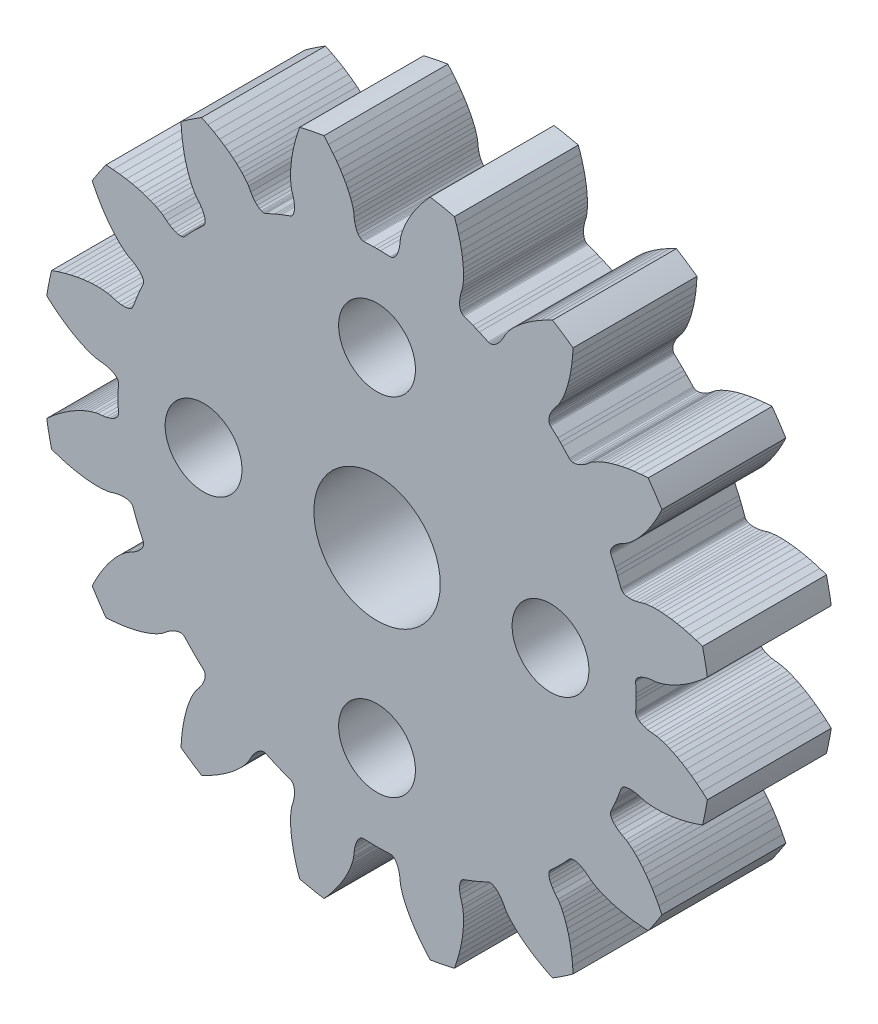
from build123d import *

# Parameters (mm, degrees)
SZKIC_R    = 1.55
SZKIC_R_2  = 2.55
GEAR_DEPTH = 5


with BuildPart() as part:
    # szkic → gear (new body)
    with BuildSketch(Plane.XY):
        with BuildLine():
            Line((-11.37066852, -6.827485358), (-11.23626822, -6.579289758))
            Line((-11.23626822, -6.579289758), (-11.10183292, -6.354069758))
            Line((-11.10183292, -6.354069758), (-10.96824992, -6.150179558))
            Line((-10.96824992, -6.150179558), (-10.83837372, -5.968985458))
            Line((-10.83837372, -5.968985458), (-10.71234172, -5.807881858))
            Line((-10.71234172, -5.807881858), (-10.59417062, -5.669192658))
            Line((-10.59417062, -5.669192658), (-10.48250752, -5.548709858))
            Line((-10.48250752, -5.548709858), (-10.38077062, -5.447719358))
            Line((-10.38077062, -5.447719358), (-10.28935352, -5.364251958))
            Line((-10.28935352, -5.364251958), (-10.14089462, -5.244330758))
            Line((-10.14089462, -5.244330758), (-10.04920092, -5.182017758))
            Line((-10.04920092, -5.182017758), (-9.88902632, -5.097985058))
            Line((-9.88902632, -5.097985058), (-9.75070002, -5.012004958))
            Line((-9.75070002, -5.012004958), (-9.63676772, -4.924255458))
            Line((-9.63676772, -4.924255458), (-9.54711732, -4.836627458))
            Line((-9.54711732, -4.836627458), (-9.48149032, -4.750972958))
            Line((-9.48149032, -4.750972958), (-9.43952592, -4.669155958))
            Line((-9.43952592, -4.669155958), (-9.42728302, -4.630249258))
            Line((-9.42728302, -4.630249258), (-9.42075652, -4.592985058))
            Line((-9.42075652, -4.592985058), (-9.41989942, -4.557582158))
            Line((-9.41989942, -4.557582158), (-9.42461042, -4.524258458))
            Line((-9.42461042, -4.524258458), (-9.43819712, -4.485865258))
            Line((-9.43819712, -4.485865258), (-9.60120132, -4.125525058))
            Line((-9.60120132, -4.125525058), (-9.65453602, -3.999037058))
            Line((-9.65453602, -3.999037058), (-9.70626322, -3.871883158))
            Line((-9.70626322, -3.871883158), (-9.84580092, -3.501822758))
            Line((-9.84580092, -3.501822758), (-9.86334172, -3.465067458))
            Line((-9.86334172, -3.465067458), (-9.88357392, -3.438172758))
            Line((-9.88357392, -3.438172758), (-9.90921372, -3.413745258))
            Line((-9.90921372, -3.413745258), (-9.94017832, -3.392010458))
            Line((-9.94017832, -3.392010458), (-9.97634662, -3.373156258))
            Line((-9.97634662, -3.373156258), (-10.06387322, -3.344976158))
            Line((-10.06387322, -3.344976158), (-10.17084542, -3.330814658))
            Line((-10.17084542, -3.330814658), (-10.29620022, -3.332244758))
            Line((-10.29620022, -3.332244758), (-10.43881072, -3.350758758))
            Line((-10.43881072, -3.350758758), (-10.59741932, -3.387773158))
            Line((-10.59741932, -3.387773158), (-10.77010002, -3.441613558))
            Line((-10.77010002, -3.441613558), (-10.87899912, -3.462388858))
            Line((-10.87899912, -3.462388858), (-11.06877252, -3.482568058))
            Line((-11.06877252, -3.482568058), (-11.19243452, -3.488189358))
            Line((-11.19243452, -3.488189358), (-11.33578442, -3.488717158))
            Line((-11.33578442, -3.488717158), (-11.49993632, -3.482480658))
            Line((-11.49993632, -3.482480658), (-11.68156412, -3.467972158))
            Line((-11.68156412, -3.467972158), (-11.88459952, -3.443172758))
            Line((-11.88459952, -3.443172758), (-12.10455952, -3.406885558))
            Line((-12.10455952, -3.406885558), (-12.34318912, -3.357170858))
            Line((-12.34318912, -3.357170858), (-12.59750382, -3.292976358))
            Line((-12.59750382, -3.292976358), (-12.86803992, -3.212510958))
            Line((-12.86803992, -3.212510958), (-13.13417922, -3.121265658))
            ThreePointArc((-13.13417922, -3.121265658), (-13.240566525, -2.633710984), (-13.328861789, -2.142557479))
            Line((-13.328861789, -2.142557479), (-13.117899289, -1.956410679))
            Line((-13.117899289, -1.956410679), (-12.898749289, -1.778540679))
            Line((-12.898749289, -1.778540679), (-12.688359289, -1.621910679))
            Line((-12.688359289, -1.621910679), (-12.486919289, -1.484660679))
            Line((-12.486919289, -1.484660679), (-12.297589289, -1.366960679))
            Line((-12.297589289, -1.366960679), (-12.119499289, -1.266350679))
            Line((-12.119499289, -1.266350679), (-11.957249289, -1.183440679))
            Line((-11.957249289, -1.183440679), (-11.807979289, -1.114860679))
            Line((-11.807979289, -1.114860679), (-11.675339289, -1.060490679))
            Line((-11.675339289, -1.060490679), (-11.558939289, -1.018360679))
            Line((-11.558939289, -1.018360679), (-11.375889289, -0.964380679))
            Line((-11.375889289, -0.964380679), (-11.267329289, -0.941900679))
            Line((-11.267329289, -0.941900679), (-11.087189289, -0.925560679))
            Line((-11.087189289, -0.925560679), (-10.926489289, -0.899060679))
            Line((-10.926489289, -0.899060679), (-10.787649289, -0.861590679))
            Line((-10.787649289, -0.861590679), (-10.671289289, -0.814940679))
            Line((-10.671289289, -0.814940679), (-10.577879289, -0.760920679))
            Line((-10.577879289, -0.760920679), (-10.507799289, -0.701390679))
            Line((-10.507799289, -0.701390679), (-10.481599289, -0.670130679))
            Line((-10.481599289, -0.670130679), (-10.461309289, -0.638200679))
            Line((-10.461309289, -0.638200679), (-10.446969289, -0.605820679))
            Line((-10.446969289, -0.605820679), (-10.438569289, -0.573230679))
            Line((-10.438569289, -0.573230679), (-10.436429289, -0.532560679))
            Line((-10.436429289, -0.532560679), (-10.449129289, -0.137270679))
            Line((-10.449129289, -0.137270679), (-10.449999289, -6.79e-07))
            Line((-10.449999289, -6.79e-07), (-10.449129289, 0.137269321))
            Line((-10.449129289, 0.137269321), (-10.436429289, 0.532559321))
            Line((-10.436429289, 0.532559321), (-10.438569289, 0.573229321))
            Line((-10.438569289, 0.573229321), (-10.446969289, 0.605819321))
            Line((-10.446969289, 0.605819321), (-10.461309289, 0.638199321))
            Line((-10.461309289, 0.638199321), (-10.481599289, 0.670129321))
            Line((-10.481599289, 0.670129321), (-10.507799289, 0.701389321))
            Line((-10.507799289, 0.701389321), (-10.577879289, 0.760919321))
            Line((-10.577879289, 0.760919321), (-10.671289289, 0.814939321))
            Line((-10.671289289, 0.814939321), (-10.787649289, 0.861589321))
            Line((-10.787649289, 0.861589321), (-10.926489289, 0.899059321))
            Line((-10.926489289, 0.899059321), (-11.087189289, 0.925559321))
            Line((-11.087189289, 0.925559321), (-11.267329289, 0.941899321))
            Line((-11.267329289, 0.941899321), (-11.375889289, 0.964379321))
            Line((-11.375889289, 0.964379321), (-11.558939289, 1.018359321))
            Line((-11.558939289, 1.018359321), (-11.675339289, 1.060489321))
            Line((-11.675339289, 1.060489321), (-11.807979289, 1.114859321))
            Line((-11.807979289, 1.114859321), (-11.957249289, 1.183439321))
            Line((-11.957249289, 1.183439321), (-12.119499289, 1.266349321))
            Line((-12.119499289, 1.266349321), (-12.297589289, 1.366959321))
            Line((-12.297589289, 1.366959321), (-12.486919289, 1.484659321))
            Line((-12.486919289, 1.484659321), (-12.688359289, 1.621909321))
            Line((-12.688359289, 1.621909321), (-12.898749289, 1.778539321))
            Line((-12.898749289, 1.778539321), (-13.117899289, 1.956409321))
            Line((-13.117899289, 1.956409321), (-13.328861789, 2.142556121))
            ThreePointArc((-13.328861789, 2.142556121), (-13.240568802, 2.633712354), (-13.134183589, 3.121269821))
            Line((-13.134183589, 3.121269821), (-12.868044289, 3.212515121))
            Line((-12.868044289, 3.212515121), (-12.597508189, 3.292980521))
            Line((-12.597508189, 3.292980521), (-12.343193489, 3.357175021))
            Line((-12.343193489, 3.357175021), (-12.104563889, 3.406889721))
            Line((-12.104563889, 3.406889721), (-11.884603889, 3.443176921))
            Line((-11.884603889, 3.443176921), (-11.681568489, 3.467976321))
            Line((-11.681568489, 3.467976321), (-11.499940689, 3.482484821))
            Line((-11.499940689, 3.482484821), (-11.335788789, 3.488721321))
            Line((-11.335788789, 3.488721321), (-11.192438889, 3.488193521))
            Line((-11.192438889, 3.488193521), (-11.068776889, 3.482572221))
            Line((-11.068776889, 3.482572221), (-10.879003489, 3.462393021))
            Line((-10.879003489, 3.462393021), (-10.770104389, 3.441617721))
            Line((-10.770104389, 3.441617721), (-10.597423689, 3.387777321))
            Line((-10.597423689, 3.387777321), (-10.438815089, 3.350762921))
            Line((-10.438815089, 3.350762921), (-10.296204589, 3.332248921))
            Line((-10.296204589, 3.332248921), (-10.170849789, 3.330818821))
            Line((-10.170849789, 3.330818821), (-10.063877589, 3.344980321))
            Line((-10.063877589, 3.344980321), (-9.976350989, 3.373160421))
            Line((-9.976350989, 3.373160421), (-9.940182689, 3.392014621))
            Line((-9.940182689, 3.392014621), (-9.909218089, 3.413749421))
            Line((-9.909218089, 3.413749421), (-9.883578289, 3.438176921))
            Line((-9.883578289, 3.438176921), (-9.863346089, 3.465071621))
            Line((-9.863346089, 3.465071621), (-9.845805289, 3.501826921))
            Line((-9.845805289, 3.501826921), (-9.706267589, 3.871887321))
            Line((-9.706267589, 3.871887321), (-9.654540389, 3.999041221))
            Line((-9.654540389, 3.999041221), (-9.601205689, 4.125529221))
            Line((-9.601205689, 4.125529221), (-9.438201489, 4.485869421))
            Line((-9.438201489, 4.485869421), (-9.424614789, 4.524262621))
            Line((-9.424614789, 4.524262621), (-9.419903789, 4.557586321))
            Line((-9.419903789, 4.557586321), (-9.420760889, 4.592989221))
            Line((-9.420760889, 4.592989221), (-9.427287389, 4.630253421))
            Line((-9.427287389, 4.630253421), (-9.439530289, 4.669160121))
            Line((-9.439530289, 4.669160121), (-9.481494689, 4.750977121))
            Line((-9.481494689, 4.750977121), (-9.547121689, 4.836631621))
            Line((-9.547121689, 4.836631621), (-9.636772089, 4.924259621))
            Line((-9.636772089, 4.924259621), (-9.750704389, 5.012009121))
            Line((-9.750704389, 5.012009121), (-9.889030689, 5.097989221))
            Line((-9.889030689, 5.097989221), (-10.049205289, 5.182021921))
            Line((-10.049205289, 5.182021921), (-10.140898989, 5.244334921))
            Line((-10.140898989, 5.244334921), (-10.289357889, 5.364256121))
            Line((-10.289357889, 5.364256121), (-10.380774989, 5.447723521))
            Line((-10.380774989, 5.447723521), (-10.482511889, 5.548714021))
            Line((-10.482511889, 5.548714021), (-10.594174989, 5.669196821))
            Line((-10.594174989, 5.669196821), (-10.712346089, 5.807886021))
            Line((-10.712346089, 5.807886021), (-10.838378089, 5.968989621))
            Line((-10.838378089, 5.968989621), (-10.968254289, 6.150183721))
            Line((-10.968254289, 6.150183721), (-11.101837289, 6.354073921))
            Line((-11.101837289, 6.354073921), (-11.236272589, 6.579293921))
            Line((-11.236272589, 6.579293921), (-11.370672889, 6.827489521))
            Line((-11.370672889, 6.827489521), (-11.494341589, 7.080198521))
            ThreePointArc((-11.494341589, 7.080198521), (-11.224812159, 7.500179363), (-10.939944885, 7.909911786))
            Line((-10.939944885, 7.909911786), (-10.659146185, 7.892364486))
            Line((-10.659146185, 7.892364486), (-10.378410685, 7.863175086))
            Line((-10.378410685, 7.863175086), (-10.118888385, 7.825160986))
            Line((-10.118888385, 7.825160986), (-9.879398385, 7.779771886))
            Line((-9.879398385, 7.779771886), (-9.662295385, 7.729121786))
            Line((-9.662295385, 7.729121786), (-9.465224685, 7.674335186))
            Line((-9.465224685, 7.674335186), (-9.291870385, 7.618233286))
            Line((-9.291870385, 7.618233286), (-9.137827185, 7.561176886))
            Line((-9.137827185, 7.561176886), (-9.005591185, 7.505831586))
            Line((-9.005591185, 7.505831586), (-8.893493485, 7.453314786))
            Line((-8.893493485, 7.453314786), (-8.725887985, 7.362048486))
            Line((-8.725887985, 7.362048486), (-8.633228685, 7.301180786))
            Line((-8.633228685, 7.301180786), (-8.494296385, 7.185356686))
            Line((-8.494296385, 7.185356686), (-8.361925985, 7.090462986))
            Line((-8.361925985, 7.090462986), (-8.237255985, 7.018783486))
            Line((-8.237255985, 7.018783486), (-8.121990485, 6.969491086))
            Line((-8.121990485, 6.969491086), (-8.017741785, 6.941638186))
            Line((-8.017741785, 6.941638186), (-7.926093685, 6.934178186))
            Line((-7.926093685, 6.934178186), (-7.885463285, 6.937756186))
            Line((-7.885463285, 6.937756186), (-7.848538185, 6.945986886))
            Line((-7.848538185, 6.945986886), (-7.815502185, 6.958743086))
            Line((-7.815502185, 6.958743086), (-7.786517885, 6.975847986))
            Line((-7.786517885, 6.975847986), (-7.756246585, 7.003092786))
            Line((-7.756246585, 7.003092786), (-7.485714585, 7.291585286))
            Line((-7.485714585, 7.291585286), (-7.389265285, 7.389265086))
            Line((-7.389265285, 7.389265086), (-7.291585485, 7.485714386))
            Line((-7.291585485, 7.485714386), (-7.003092985, 7.756246386))
            Line((-7.003092985, 7.756246386), (-6.975848185, 7.786517686))
            Line((-6.975848185, 7.786517686), (-6.958743285, 7.815501986))
            Line((-6.958743285, 7.815501986), (-6.945987085, 7.848537986))
            Line((-6.945987085, 7.848537986), (-6.937756385, 7.885463086))
            Line((-6.937756385, 7.885463086), (-6.934178385, 7.926093486))
            Line((-6.934178385, 7.926093486), (-6.941638385, 8.017741586))
            Line((-6.941638385, 8.017741586), (-6.969491285, 8.121990286))
            Line((-6.969491285, 8.121990286), (-7.018783685, 8.237255786))
            Line((-7.018783685, 8.237255786), (-7.090463185, 8.361925786))
            Line((-7.090463185, 8.361925786), (-7.185356885, 8.494296186))
            Line((-7.185356885, 8.494296186), (-7.301180985, 8.633228486))
            Line((-7.301180985, 8.633228486), (-7.362048685, 8.725887786))
            Line((-7.362048685, 8.725887786), (-7.453314985, 8.893493286))
            Line((-7.453314985, 8.893493286), (-7.505831785, 9.005590986))
            Line((-7.505831785, 9.005590986), (-7.561177085, 9.137826986))
            Line((-7.561177085, 9.137826986), (-7.618233485, 9.291870186))
            Line((-7.618233485, 9.291870186), (-7.674335385, 9.465224486))
            Line((-7.674335385, 9.465224486), (-7.729121985, 9.662295186))
            Line((-7.729121985, 9.662295186), (-7.779772085, 9.879398186))
            Line((-7.779772085, 9.879398186), (-7.825161185, 10.118888186))
            Line((-7.825161185, 10.118888186), (-7.863175285, 10.378410486))
            Line((-7.863175285, 10.378410486), (-7.892364685, 10.659145986))
            Line((-7.892364685, 10.659145986), (-7.909911985, 10.939944686))
            ThreePointArc((-7.909911985, 10.939944686), (-7.500179744, 11.224812366), (-7.080199065, 11.494342204))
            Line((-7.080199065, 11.494342204), (-6.827490065, 11.370673504))
            Line((-6.827490065, 11.370673504), (-6.579294465, 11.236273204))
            Line((-6.579294465, 11.236273204), (-6.354074465, 11.101837904))
            Line((-6.354074465, 11.101837904), (-6.150184265, 10.968254904))
            Line((-6.150184265, 10.968254904), (-5.968990165, 10.838378704))
            Line((-5.968990165, 10.838378704), (-5.807886565, 10.712346704))
            Line((-5.807886565, 10.712346704), (-5.669197365, 10.594175604))
            Line((-5.669197365, 10.594175604), (-5.548714565, 10.482512504))
            Line((-5.548714565, 10.482512504), (-5.447724065, 10.380775604))
            Line((-5.447724065, 10.380775604), (-5.364256665, 10.289358504))
            Line((-5.364256665, 10.289358504), (-5.244335465, 10.140899604))
            Line((-5.244335465, 10.140899604), (-5.182022465, 10.049205904))
            Line((-5.182022465, 10.049205904), (-5.097989765, 9.889031304))
            Line((-5.097989765, 9.889031304), (-5.012009665, 9.750705004))
            Line((-5.012009665, 9.750705004), (-4.924260165, 9.636772704))
            Line((-4.924260165, 9.636772704), (-4.836632165, 9.547122304))
            Line((-4.836632165, 9.547122304), (-4.750977665, 9.481495304))
            Line((-4.750977665, 9.481495304), (-4.669160665, 9.439530904))
            Line((-4.669160665, 9.439530904), (-4.630253965, 9.427288004))
            Line((-4.630253965, 9.427288004), (-4.592989765, 9.420761504))
            Line((-4.592989765, 9.420761504), (-4.557586865, 9.419904404))
            Line((-4.557586865, 9.419904404), (-4.524263165, 9.424615404))
            Line((-4.524263165, 9.424615404), (-4.485869965, 9.438202104))
            Line((-4.485869965, 9.438202104), (-4.125529765, 9.601206304))
            Line((-4.125529765, 9.601206304), (-3.999041765, 9.654541004))
            Line((-3.999041765, 9.654541004), (-3.871887865, 9.706268204))
            Line((-3.871887865, 9.706268204), (-3.501827465, 9.845805904))
            Line((-3.501827465, 9.845805904), (-3.465072165, 9.863346704))
            Line((-3.465072165, 9.863346704), (-3.438177465, 9.883578904))
            Line((-3.438177465, 9.883578904), (-3.413749965, 9.909218704))
            Line((-3.413749965, 9.909218704), (-3.392015165, 9.940183304))
            Line((-3.392015165, 9.940183304), (-3.373160965, 9.976351604))
            Line((-3.373160965, 9.976351604), (-3.344980865, 10.063878204))
            Line((-3.344980865, 10.063878204), (-3.330819365, 10.170850404))
            Line((-3.330819365, 10.170850404), (-3.332249465, 10.296205204))
            Line((-3.332249465, 10.296205204), (-3.350763465, 10.438815704))
            Line((-3.350763465, 10.438815704), (-3.387777865, 10.597424304))
            Line((-3.387777865, 10.597424304), (-3.441618265, 10.770105004))
            Line((-3.441618265, 10.770105004), (-3.462393565, 10.879004104))
            Line((-3.462393565, 10.879004104), (-3.482572765, 11.068777504))
            Line((-3.482572765, 11.068777504), (-3.488194065, 11.192439504))
            Line((-3.488194065, 11.192439504), (-3.488721865, 11.335789404))
            Line((-3.488721865, 11.335789404), (-3.482485365, 11.499941304))
            Line((-3.482485365, 11.499941304), (-3.467976865, 11.681569104))
            Line((-3.467976865, 11.681569104), (-3.443177465, 11.884604504))
            Line((-3.443177465, 11.884604504), (-3.406890265, 12.104564504))
            Line((-3.406890265, 12.104564504), (-3.357175565, 12.343194104))
            Line((-3.357175565, 12.343194104), (-3.292981065, 12.597508804))
            Line((-3.292981065, 12.597508804), (-3.212515665, 12.868044904))
            Line((-3.212515665, 12.868044904), (-3.121270365, 13.134184204))
            ThreePointArc((-3.121270365, 13.134184204), (-2.633712898, 13.240569417), (-2.142556665, 13.328862404))
            Line((-2.142556665, 13.328862404), (-1.956409865, 13.117899904))
            Line((-1.956409865, 13.117899904), (-1.778539865, 12.898749904))
            Line((-1.778539865, 12.898749904), (-1.621909865, 12.688359904))
            Line((-1.621909865, 12.688359904), (-1.484659865, 12.486919904))
            Line((-1.484659865, 12.486919904), (-1.366959865, 12.297589904))
            Line((-1.366959865, 12.297589904), (-1.266349865, 12.119499904))
            Line((-1.266349865, 12.119499904), (-1.183439865, 11.957249904))
            Line((-1.183439865, 11.957249904), (-1.114859865, 11.807979904))
            Line((-1.114859865, 11.807979904), (-1.060489865, 11.675339904))
            Line((-1.060489865, 11.675339904), (-1.018359865, 11.558939904))
            Line((-1.018359865, 11.558939904), (-0.964379865, 11.375889904))
            Line((-0.964379865, 11.375889904), (-0.941899865, 11.267329904))
            Line((-0.941899865, 11.267329904), (-0.925559865, 11.087189904))
            Line((-0.925559865, 11.087189904), (-0.899059865, 10.926489904))
            Line((-0.899059865, 10.926489904), (-0.861589865, 10.787649904))
            Line((-0.861589865, 10.787649904), (-0.814939865, 10.671289904))
            Line((-0.814939865, 10.671289904), (-0.760919865, 10.577879904))
            Line((-0.760919865, 10.577879904), (-0.701389865, 10.507799904))
            Line((-0.701389865, 10.507799904), (-0.670129865, 10.481599904))
            Line((-0.670129865, 10.481599904), (-0.638199865, 10.461309904))
            Line((-0.638199865, 10.461309904), (-0.605819865, 10.446969904))
            Line((-0.605819865, 10.446969904), (-0.573229865, 10.438569904))
            Line((-0.573229865, 10.438569904), (-0.532559865, 10.436429904))
            Line((-0.532559865, 10.436429904), (-0.137269865, 10.449129904))
            Line((-0.137269865, 10.449129904), (1.35e-07, 10.449999904))
            Line((1.35e-07, 10.449999904), (0.137270135, 10.449129904))
            Line((0.137270135, 10.449129904), (0.532560135, 10.436429904))
            Line((0.532560135, 10.436429904), (0.573230135, 10.438569904))
            Line((0.573230135, 10.438569904), (0.605820135, 10.446969904))
            Line((0.605820135, 10.446969904), (0.638200135, 10.461309904))
            Line((0.638200135, 10.461309904), (0.670130135, 10.481599904))
            Line((0.670130135, 10.481599904), (0.701390135, 10.507799904))
            Line((0.701390135, 10.507799904), (0.760920135, 10.577879904))
            Line((0.760920135, 10.577879904), (0.814940135, 10.671289904))
            Line((0.814940135, 10.671289904), (0.861590135, 10.787649904))
            Line((0.861590135, 10.787649904), (0.899060135, 10.926489904))
            Line((0.899060135, 10.926489904), (0.925560135, 11.087189904))
            Line((0.925560135, 11.087189904), (0.941900135, 11.267329904))
            Line((0.941900135, 11.267329904), (0.964380135, 11.375889904))
            Line((0.964380135, 11.375889904), (1.018360135, 11.558939904))
            Line((1.018360135, 11.558939904), (1.060490135, 11.675339904))
            Line((1.060490135, 11.675339904), (1.114860135, 11.807979904))
            Line((1.114860135, 11.807979904), (1.183440135, 11.957249904))
            Line((1.183440135, 11.957249904), (1.266350135, 12.119499904))
            Line((1.266350135, 12.119499904), (1.366960135, 12.297589904))
            Line((1.366960135, 12.297589904), (1.484660135, 12.486919904))
            Line((1.484660135, 12.486919904), (1.621910135, 12.688359904))
            Line((1.621910135, 12.688359904), (1.778540135, 12.898749904))
            Line((1.778540135, 12.898749904), (1.956410135, 13.117899904))
            Line((1.956410135, 13.117899904), (2.142556935, 13.328862404))
            ThreePointArc((2.142556935, 13.328862404), (2.633713168, 13.240569417), (3.121270635, 13.134184204))
            Line((3.121270635, 13.134184204), (3.212515935, 12.868044904))
            Line((3.212515935, 12.868044904), (3.292981335, 12.597508804))
            Line((3.292981335, 12.597508804), (3.357175835, 12.343194104))
            Line((3.357175835, 12.343194104), (3.406890535, 12.104564504))
            Line((3.406890535, 12.104564504), (3.443177735, 11.884604504))
            Line((3.443177735, 11.884604504), (3.467977135, 11.681569104))
            Line((3.467977135, 11.681569104), (3.482485635, 11.499941304))
            Line((3.482485635, 11.499941304), (3.488722135, 11.335789404))
            Line((3.488722135, 11.335789404), (3.488194335, 11.192439504))
            Line((3.488194335, 11.192439504), (3.482573035, 11.068777504))
            Line((3.482573035, 11.068777504), (3.462393835, 10.879004104))
            Line((3.462393835, 10.879004104), (3.441618535, 10.770105004))
            Line((3.441618535, 10.770105004), (3.387778135, 10.597424304))
            Line((3.387778135, 10.597424304), (3.350763735, 10.438815704))
            Line((3.350763735, 10.438815704), (3.332249735, 10.296205204))
            Line((3.332249735, 10.296205204), (3.330819635, 10.170850404))
            Line((3.330819635, 10.170850404), (3.344981135, 10.063878204))
            Line((3.344981135, 10.063878204), (3.373161235, 9.976351604))
            Line((3.373161235, 9.976351604), (3.392015435, 9.940183304))
            Line((3.392015435, 9.940183304), (3.413750235, 9.909218704))
            Line((3.413750235, 9.909218704), (3.438177735, 9.883578904))
            Line((3.438177735, 9.883578904), (3.465072435, 9.863346704))
            Line((3.465072435, 9.863346704), (3.501827735, 9.845805904))
            Line((3.501827735, 9.845805904), (3.871888135, 9.706268204))
            Line((3.871888135, 9.706268204), (3.999042035, 9.654541004))
            Line((3.999042035, 9.654541004), (4.125530035, 9.601206304))
            Line((4.125530035, 9.601206304), (4.485870235, 9.438202104))
            Line((4.485870235, 9.438202104), (4.524263435, 9.424615404))
            Line((4.524263435, 9.424615404), (4.557587135, 9.419904404))
            Line((4.557587135, 9.419904404), (4.592990035, 9.420761504))
            Line((4.592990035, 9.420761504), (4.630254235, 9.427288004))
            Line((4.630254235, 9.427288004), (4.669160935, 9.439530904))
            Line((4.669160935, 9.439530904), (4.750977935, 9.481495304))
            Line((4.750977935, 9.481495304), (4.836632435, 9.547122304))
            Line((4.836632435, 9.547122304), (4.924260435, 9.636772704))
            Line((4.924260435, 9.636772704), (5.012009935, 9.750705004))
            Line((5.012009935, 9.750705004), (5.097990035, 9.889031304))
            Line((5.097990035, 9.889031304), (5.182022735, 10.049205904))
            Line((5.182022735, 10.049205904), (5.244335735, 10.140899604))
            Line((5.244335735, 10.140899604), (5.364256935, 10.289358504))
            Line((5.364256935, 10.289358504), (5.447724335, 10.380775604))
            Line((5.447724335, 10.380775604), (5.548714835, 10.482512504))
            Line((5.548714835, 10.482512504), (5.669197635, 10.594175604))
            Line((5.669197635, 10.594175604), (5.807886835, 10.712346704))
            Line((5.807886835, 10.712346704), (5.968990435, 10.838378704))
            Line((5.968990435, 10.838378704), (6.150184535, 10.968254904))
            Line((6.150184535, 10.968254904), (6.354074735, 11.101837904))
            Line((6.354074735, 11.101837904), (6.579294735, 11.236273204))
            Line((6.579294735, 11.236273204), (6.827490335, 11.370673504))
            Line((6.827490335, 11.370673504), (7.080199335, 11.494342204))
            ThreePointArc((7.080199335, 11.494342204), (7.500180178, 11.224812774), (7.9099126, 10.9399455))
            Line((7.9099126, 10.9399455), (7.8923653, 10.6591468))
            Line((7.8923653, 10.6591468), (7.8631759, 10.3784113))
            Line((7.8631759, 10.3784113), (7.8251618, 10.118889))
            Line((7.8251618, 10.118889), (7.7797727, 9.879399))
            Line((7.7797727, 9.879399), (7.7291226, 9.662296))
            Line((7.7291226, 9.662296), (7.674336, 9.4652253))
            Line((7.674336, 9.4652253), (7.6182341, 9.291871))
            Line((7.6182341, 9.291871), (7.5611777, 9.1378278))
            Line((7.5611777, 9.1378278), (7.5058324, 9.0055918))
            Line((7.5058324, 9.0055918), (7.4533156, 8.8934941))
            Line((7.4533156, 8.8934941), (7.3620493, 8.7258886))
            Line((7.3620493, 8.7258886), (7.3011816, 8.6332293))
            Line((7.3011816, 8.6332293), (7.1853575, 8.494297))
            Line((7.1853575, 8.494297), (7.0904638, 8.3619266))
            Line((7.0904638, 8.3619266), (7.0187843, 8.2372566))
            Line((7.0187843, 8.2372566), (6.9694919, 8.1219911))
            Line((6.9694919, 8.1219911), (6.941639, 8.0177424))
            Line((6.941639, 8.0177424), (6.934179, 7.9260943))
            Line((6.934179, 7.9260943), (6.937757, 7.8854639))
            Line((6.937757, 7.8854639), (6.9459877, 7.8485388))
            Line((6.9459877, 7.8485388), (6.9587439, 7.8155028))
            Line((6.9587439, 7.8155028), (6.9758488, 7.7865185))
            Line((6.9758488, 7.7865185), (7.0030936, 7.7562472))
            Line((7.0030936, 7.7562472), (7.2915861, 7.4857152))
            Line((7.2915861, 7.4857152), (7.3892659, 7.3892659))
            Line((7.3892659, 7.3892659), (7.4857152, 7.2915861))
            Line((7.4857152, 7.2915861), (7.7562472, 7.0030936))
            Line((7.7562472, 7.0030936), (7.7865185, 6.9758488))
            Line((7.7865185, 6.9758488), (7.8155028, 6.9587439))
            Line((7.8155028, 6.9587439), (7.8485388, 6.9459877))
            Line((7.8485388, 6.9459877), (7.8854639, 6.937757))
            Line((7.8854639, 6.937757), (7.9260943, 6.934179))
            Line((7.9260943, 6.934179), (8.0177424, 6.941639))
            Line((8.0177424, 6.941639), (8.1219911, 6.9694919))
            Line((8.1219911, 6.9694919), (8.2372566, 7.0187843))
            Line((8.2372566, 7.0187843), (8.3619266, 7.0904638))
            Line((8.3619266, 7.0904638), (8.494297, 7.1853575))
            Line((8.494297, 7.1853575), (8.6332293, 7.3011816))
            Line((8.6332293, 7.3011816), (8.7258886, 7.3620493))
            Line((8.7258886, 7.3620493), (8.8934941, 7.4533156))
            Line((8.8934941, 7.4533156), (9.0055918, 7.5058324))
            Line((9.0055918, 7.5058324), (9.1378278, 7.5611777))
            Line((9.1378278, 7.5611777), (9.291871, 7.6182341))
            Line((9.291871, 7.6182341), (9.4652253, 7.674336))
            Line((9.4652253, 7.674336), (9.662296, 7.7291226))
            Line((9.662296, 7.7291226), (9.879399, 7.7797727))
            Line((9.879399, 7.7797727), (10.118889, 7.8251618))
            Line((10.118889, 7.8251618), (10.3784113, 7.8631759))
            Line((10.3784113, 7.8631759), (10.6591468, 7.8923653))
            Line((10.6591468, 7.8923653), (10.9399455, 7.9099126))
            ThreePointArc((10.9399455, 7.9099126), (11.22481318, 7.500180359), (11.494343018, 7.08019968))
            Line((11.494343018, 7.08019968), (11.370674318, 6.82749068))
            Line((11.370674318, 6.82749068), (11.236274018, 6.57929508))
            Line((11.236274018, 6.57929508), (11.101838718, 6.35407508))
            Line((11.101838718, 6.35407508), (10.968255718, 6.15018488))
            Line((10.968255718, 6.15018488), (10.838379518, 5.96899078))
            Line((10.838379518, 5.96899078), (10.712347518, 5.80788718))
            Line((10.712347518, 5.80788718), (10.594176418, 5.66919798))
            Line((10.594176418, 5.66919798), (10.482513318, 5.54871518))
            Line((10.482513318, 5.54871518), (10.380776418, 5.44772468))
            Line((10.380776418, 5.44772468), (10.289359318, 5.36425728))
            Line((10.289359318, 5.36425728), (10.140900418, 5.24433608))
            Line((10.140900418, 5.24433608), (10.049206718, 5.18202308))
            Line((10.049206718, 5.18202308), (9.889032118, 5.09799038))
            Line((9.889032118, 5.09799038), (9.750705818, 5.01201028))
            Line((9.750705818, 5.01201028), (9.636773518, 4.92426078))
            Line((9.636773518, 4.92426078), (9.547123118, 4.83663278))
            Line((9.547123118, 4.83663278), (9.481496118, 4.75097828))
            Line((9.481496118, 4.75097828), (9.439531718, 4.66916128))
            Line((9.439531718, 4.66916128), (9.427288818, 4.63025458))
            Line((9.427288818, 4.63025458), (9.420762318, 4.59299038))
            Line((9.420762318, 4.59299038), (9.419905218, 4.55758748))
            Line((9.419905218, 4.55758748), (9.424616218, 4.52426378))
            Line((9.424616218, 4.52426378), (9.438202918, 4.48587058))
            Line((9.438202918, 4.48587058), (9.601207118, 4.12553038))
            Line((9.601207118, 4.12553038), (9.654541818, 3.99904238))
            Line((9.654541818, 3.99904238), (9.706269018, 3.87188848))
            Line((9.706269018, 3.87188848), (9.845806718, 3.50182808))
            Line((9.845806718, 3.50182808), (9.863347518, 3.46507278))
            Line((9.863347518, 3.46507278), (9.883579718, 3.43817808))
            Line((9.883579718, 3.43817808), (9.909219518, 3.41375058))
            Line((9.909219518, 3.41375058), (9.940184118, 3.39201578))
            Line((9.940184118, 3.39201578), (9.976352418, 3.37316158))
            Line((9.976352418, 3.37316158), (10.063879018, 3.34498148))
            Line((10.063879018, 3.34498148), (10.170851218, 3.33081998))
            Line((10.170851218, 3.33081998), (10.296206018, 3.33225008))
            Line((10.296206018, 3.33225008), (10.438816518, 3.35076408))
            Line((10.438816518, 3.35076408), (10.597425118, 3.38777848))
            Line((10.597425118, 3.38777848), (10.770105818, 3.44161888))
            Line((10.770105818, 3.44161888), (10.879004918, 3.46239418))
            Line((10.879004918, 3.46239418), (11.068778318, 3.48257338))
            Line((11.068778318, 3.48257338), (11.192440318, 3.48819468))
            Line((11.192440318, 3.48819468), (11.335790218, 3.48872248))
            Line((11.335790218, 3.48872248), (11.499942118, 3.48248598))
            Line((11.499942118, 3.48248598), (11.681569918, 3.46797748))
            Line((11.681569918, 3.46797748), (11.884605318, 3.44317808))
            Line((11.884605318, 3.44317808), (12.104565318, 3.40689088))
            Line((12.104565318, 3.40689088), (12.343194918, 3.35717618))
            Line((12.343194918, 3.35717618), (12.597509618, 3.29298168))
            Line((12.597509618, 3.29298168), (12.868045718, 3.21251628))
            Line((12.868045718, 3.21251628), (13.134185018, 3.12127098))
            ThreePointArc((13.134185018, 3.12127098), (13.240570231, 2.633713513), (13.328863218, 2.14255728))
            Line((13.328863218, 2.14255728), (13.117900718, 1.95641048))
            Line((13.117900718, 1.95641048), (12.898750718, 1.77854048))
            Line((12.898750718, 1.77854048), (12.688360718, 1.62191048))
            Line((12.688360718, 1.62191048), (12.486920718, 1.48466048))
            Line((12.486920718, 1.48466048), (12.297590718, 1.36696048))
            Line((12.297590718, 1.36696048), (12.119500718, 1.26635048))
            Line((12.119500718, 1.26635048), (11.957250718, 1.18344048))
            Line((11.957250718, 1.18344048), (11.807980718, 1.11486048))
            Line((11.807980718, 1.11486048), (11.675340718, 1.06049048))
            Line((11.675340718, 1.06049048), (11.558940718, 1.01836048))
            Line((11.558940718, 1.01836048), (11.375890718, 0.96438048))
            Line((11.375890718, 0.96438048), (11.267330718, 0.94190048))
            Line((11.267330718, 0.94190048), (11.087190718, 0.92556048))
            Line((11.087190718, 0.92556048), (10.926490718, 0.89906048))
            Line((10.926490718, 0.89906048), (10.787650718, 0.86159048))
            Line((10.787650718, 0.86159048), (10.671290718, 0.81494048))
            Line((10.671290718, 0.81494048), (10.577880718, 0.76092048))
            Line((10.577880718, 0.76092048), (10.507800718, 0.70139048))
            Line((10.507800718, 0.70139048), (10.481600718, 0.67013048))
            Line((10.481600718, 0.67013048), (10.461310718, 0.63820048))
            Line((10.461310718, 0.63820048), (10.446970718, 0.60582048))
            Line((10.446970718, 0.60582048), (10.438570718, 0.57323048))
            Line((10.438570718, 0.57323048), (10.436430718, 0.53256048))
            Line((10.436430718, 0.53256048), (10.449130718, 0.13727048))
            Line((10.449130718, 0.13727048), (10.450000718, 4.8e-07))
            Line((10.450000718, 4.8e-07), (10.449130718, -0.13726952))
            Line((10.449130718, -0.13726952), (10.436430718, -0.53255952))
            Line((10.436430718, -0.53255952), (10.438570718, -0.57322952))
            Line((10.438570718, -0.57322952), (10.446970718, -0.60581952))
            Line((10.446970718, -0.60581952), (10.461310718, -0.63819952))
            Line((10.461310718, -0.63819952), (10.481600718, -0.67012952))
            Line((10.481600718, -0.67012952), (10.507800718, -0.70138952))
            Line((10.507800718, -0.70138952), (10.577880718, -0.76091952))
            Line((10.577880718, -0.76091952), (10.671290718, -0.81493952))
            Line((10.671290718, -0.81493952), (10.787650718, -0.86158952))
            Line((10.787650718, -0.86158952), (10.926490718, -0.89905952))
            Line((10.926490718, -0.89905952), (11.087190718, -0.92555952))
            Line((11.087190718, -0.92555952), (11.267330718, -0.94189952))
            Line((11.267330718, -0.94189952), (11.375890718, -0.96437952))
            Line((11.375890718, -0.96437952), (11.558940718, -1.01835952))
            Line((11.558940718, -1.01835952), (11.675340718, -1.06048952))
            Line((11.675340718, -1.06048952), (11.807980718, -1.11485952))
            Line((11.807980718, -1.11485952), (11.957250718, -1.18343952))
            Line((11.957250718, -1.18343952), (12.119500718, -1.26634952))
            Line((12.119500718, -1.26634952), (12.297590718, -1.36695952))
            Line((12.297590718, -1.36695952), (12.486920718, -1.48465952))
            Line((12.486920718, -1.48465952), (12.688360718, -1.62190952))
            Line((12.688360718, -1.62190952), (12.898750718, -1.77853952))
            Line((12.898750718, -1.77853952), (13.117900718, -1.95640952))
            Line((13.117900718, -1.95640952), (13.328863218, -2.14255632))
            ThreePointArc((13.328863218, -2.14255632), (13.240570231, -2.633712553), (13.134185018, -3.12127002))
            Line((13.134185018, -3.12127002), (12.868045718, -3.21251532))
            Line((12.868045718, -3.21251532), (12.597509618, -3.29298072))
            Line((12.597509618, -3.29298072), (12.343194918, -3.35717522))
            Line((12.343194918, -3.35717522), (12.104565318, -3.40688992))
            Line((12.104565318, -3.40688992), (11.884605318, -3.44317712))
            Line((11.884605318, -3.44317712), (11.681569918, -3.46797652))
            Line((11.681569918, -3.46797652), (11.499942118, -3.48248502))
            Line((11.499942118, -3.48248502), (11.335790218, -3.48872152))
            Line((11.335790218, -3.48872152), (11.192440318, -3.48819372))
            Line((11.192440318, -3.48819372), (11.068778318, -3.48257242))
            Line((11.068778318, -3.48257242), (10.879004918, -3.46239322))
            Line((10.879004918, -3.46239322), (10.770105818, -3.44161792))
            Line((10.770105818, -3.44161792), (10.597425118, -3.38777752))
            Line((10.597425118, -3.38777752), (10.438816518, -3.35076312))
            Line((10.438816518, -3.35076312), (10.296206018, -3.33224912))
            Line((10.296206018, -3.33224912), (10.170851218, -3.33081902))
            Line((10.170851218, -3.33081902), (10.063879018, -3.34498052))
            Line((10.063879018, -3.34498052), (9.976352418, -3.37316062))
            Line((9.976352418, -3.37316062), (9.940184118, -3.39201482))
            Line((9.940184118, -3.39201482), (9.909219518, -3.41374962))
            Line((9.909219518, -3.41374962), (9.883579718, -3.43817712))
            Line((9.883579718, -3.43817712), (9.863347518, -3.46507182))
            Line((9.863347518, -3.46507182), (9.845806718, -3.50182712))
            Line((9.845806718, -3.50182712), (9.706269018, -3.87188752))
            Line((9.706269018, -3.87188752), (9.654541818, -3.99904142))
            Line((9.654541818, -3.99904142), (9.601207118, -4.12552942))
            Line((9.601207118, -4.12552942), (9.438202918, -4.48586962))
            Line((9.438202918, -4.48586962), (9.424616218, -4.52426282))
            Line((9.424616218, -4.52426282), (9.419905218, -4.55758652))
            Line((9.419905218, -4.55758652), (9.420762318, -4.59298942))
            Line((9.420762318, -4.59298942), (9.427288818, -4.63025362))
            Line((9.427288818, -4.63025362), (9.439531718, -4.66916032))
            Line((9.439531718, -4.66916032), (9.481496118, -4.75097732))
            Line((9.481496118, -4.75097732), (9.547123118, -4.83663182))
            Line((9.547123118, -4.83663182), (9.636773518, -4.92425982))
            Line((9.636773518, -4.92425982), (9.750705818, -5.01200932))
            Line((9.750705818, -5.01200932), (9.889032118, -5.09798942))
            Line((9.889032118, -5.09798942), (10.049206718, -5.18202212))
            Line((10.049206718, -5.18202212), (10.140900418, -5.24433512))
            Line((10.140900418, -5.24433512), (10.289359318, -5.36425632))
            Line((10.289359318, -5.36425632), (10.380776418, -5.44772372))
            Line((10.380776418, -5.44772372), (10.482513318, -5.54871422))
            Line((10.482513318, -5.54871422), (10.594176418, -5.66919702))
            Line((10.594176418, -5.66919702), (10.712347518, -5.80788622))
            Line((10.712347518, -5.80788622), (10.838379518, -5.96898982))
            Line((10.838379518, -5.96898982), (10.968255718, -6.15018392))
            Line((10.968255718, -6.15018392), (11.101838718, -6.35407412))
            Line((11.101838718, -6.35407412), (11.236274018, -6.57929412))
            Line((11.236274018, -6.57929412), (11.370674318, -6.82748972))
            Line((11.370674318, -6.82748972), (11.494343018, -7.08019872))
            ThreePointArc((11.494343018, -7.08019872), (11.224814723, -7.500177576), (10.939948718, -7.909908097))
            Line((10.939948718, -7.909908097), (10.659150018, -7.892360797))
            Line((10.659150018, -7.892360797), (10.378414518, -7.863171397))
            Line((10.378414518, -7.863171397), (10.118892218, -7.825157297))
            Line((10.118892218, -7.825157297), (9.879402218, -7.779768197))
            Line((9.879402218, -7.779768197), (9.662299218, -7.729118097))
            Line((9.662299218, -7.729118097), (9.465228518, -7.674331497))
            Line((9.465228518, -7.674331497), (9.291874218, -7.618229597))
            Line((9.291874218, -7.618229597), (9.137831018, -7.561173197))
            Line((9.137831018, -7.561173197), (9.005595018, -7.505827897))
            Line((9.005595018, -7.505827897), (8.893497318, -7.453311097))
            Line((8.893497318, -7.453311097), (8.725891818, -7.362044797))
            Line((8.725891818, -7.362044797), (8.633232518, -7.301177097))
            Line((8.633232518, -7.301177097), (8.494300218, -7.185352997))
            Line((8.494300218, -7.185352997), (8.361929818, -7.090459297))
            Line((8.361929818, -7.090459297), (8.237259818, -7.018779797))
            Line((8.237259818, -7.018779797), (8.121994318, -6.969487397))
            Line((8.121994318, -6.969487397), (8.017745618, -6.941634497))
            Line((8.017745618, -6.941634497), (7.926097518, -6.934174497))
            Line((7.926097518, -6.934174497), (7.885467118, -6.937752497))
            Line((7.885467118, -6.937752497), (7.848542018, -6.945983197))
            Line((7.848542018, -6.945983197), (7.815506018, -6.958739397))
            Line((7.815506018, -6.958739397), (7.786521718, -6.975844297))
            Line((7.786521718, -6.975844297), (7.756250418, -7.003089097))
            Line((7.756250418, -7.003089097), (7.485718418, -7.291581597))
            Line((7.485718418, -7.291581597), (7.389269118, -7.389261397))
            Line((7.389269118, -7.389261397), (7.291589318, -7.485710697))
            Line((7.291589318, -7.485710697), (7.003096818, -7.756242697))
            Line((7.003096818, -7.756242697), (6.975852018, -7.786513997))
            Line((6.975852018, -7.786513997), (6.958747118, -7.815498297))
            Line((6.958747118, -7.815498297), (6.945990918, -7.848534297))
            Line((6.945990918, -7.848534297), (6.937760218, -7.885459397))
            Line((6.937760218, -7.885459397), (6.934182218, -7.926089797))
            Line((6.934182218, -7.926089797), (6.941642218, -8.017737897))
            Line((6.941642218, -8.017737897), (6.969495118, -8.121986597))
            Line((6.969495118, -8.121986597), (7.018787518, -8.237252097))
            Line((7.018787518, -8.237252097), (7.090467018, -8.361922097))
            Line((7.090467018, -8.361922097), (7.185360718, -8.494292497))
            Line((7.185360718, -8.494292497), (7.301184818, -8.633224797))
            Line((7.301184818, -8.633224797), (7.362052518, -8.725884097))
            Line((7.362052518, -8.725884097), (7.453318818, -8.893489597))
            Line((7.453318818, -8.893489597), (7.505835618, -9.005587297))
            Line((7.505835618, -9.005587297), (7.561180918, -9.137823297))
            Line((7.561180918, -9.137823297), (7.618237318, -9.291866497))
            Line((7.618237318, -9.291866497), (7.674339218, -9.465220797))
            Line((7.674339218, -9.465220797), (7.729125818, -9.662291497))
            Line((7.729125818, -9.662291497), (7.779775918, -9.879394497))
            Line((7.779775918, -9.879394497), (7.825165018, -10.118884497))
            Line((7.825165018, -10.118884497), (7.863179118, -10.378406797))
            Line((7.863179118, -10.378406797), (7.892368518, -10.659142297))
            Line((7.892368518, -10.659142297), (7.909915818, -10.939940997))
            ThreePointArc((7.909915818, -10.939940997), (7.500184611, -11.224807887), (7.080205016, -11.494337005))
            Line((7.080205016, -11.494337005), (6.827496016, -11.370668305))
            Line((6.827496016, -11.370668305), (6.579300416, -11.236268005))
            Line((6.579300416, -11.236268005), (6.354080416, -11.101832705))
            Line((6.354080416, -11.101832705), (6.150190216, -10.968249705))
            Line((6.150190216, -10.968249705), (5.968996116, -10.838373505))
            Line((5.968996116, -10.838373505), (5.807892516, -10.712341505))
            Line((5.807892516, -10.712341505), (5.669203316, -10.594170405))
            Line((5.669203316, -10.594170405), (5.548720516, -10.482507305))
            Line((5.548720516, -10.482507305), (5.447730016, -10.380770405))
            Line((5.447730016, -10.380770405), (5.364262616, -10.289353305))
            Line((5.364262616, -10.289353305), (5.244341416, -10.140894405))
            Line((5.244341416, -10.140894405), (5.182028416, -10.049200705))
            Line((5.182028416, -10.049200705), (5.097995716, -9.889026105))
            Line((5.097995716, -9.889026105), (5.012015616, -9.750699805))
            Line((5.012015616, -9.750699805), (4.924266116, -9.636767505))
            Line((4.924266116, -9.636767505), (4.836638116, -9.547117105))
            Line((4.836638116, -9.547117105), (4.750983616, -9.481490105))
            Line((4.750983616, -9.481490105), (4.669166616, -9.439525705))
            Line((4.669166616, -9.439525705), (4.630259916, -9.427282805))
            Line((4.630259916, -9.427282805), (4.592995716, -9.420756305))
            Line((4.592995716, -9.420756305), (4.557592816, -9.419899205))
            Line((4.557592816, -9.419899205), (4.524269116, -9.424610205))
            Line((4.524269116, -9.424610205), (4.485875916, -9.438196905))
            Line((4.485875916, -9.438196905), (4.125535716, -9.601201105))
            Line((4.125535716, -9.601201105), (3.999047716, -9.654535805))
            Line((3.999047716, -9.654535805), (3.871893816, -9.706263005))
            Line((3.871893816, -9.706263005), (3.501833416, -9.845800705))
            Line((3.501833416, -9.845800705), (3.465078116, -9.863341505))
            Line((3.465078116, -9.863341505), (3.438183416, -9.883573705))
            Line((3.438183416, -9.883573705), (3.413755916, -9.909213505))
            Line((3.413755916, -9.909213505), (3.392021116, -9.940178105))
            Line((3.392021116, -9.940178105), (3.373166916, -9.976346405))
            Line((3.373166916, -9.976346405), (3.344986816, -10.063873005))
            Line((3.344986816, -10.063873005), (3.330825316, -10.170845205))
            Line((3.330825316, -10.170845205), (3.332255416, -10.296200005))
            Line((3.332255416, -10.296200005), (3.350769416, -10.438810505))
            Line((3.350769416, -10.438810505), (3.387783816, -10.597419105))
            Line((3.387783816, -10.597419105), (3.441624216, -10.770099805))
            Line((3.441624216, -10.770099805), (3.462399516, -10.878998905))
            Line((3.462399516, -10.878998905), (3.482578716, -11.068772305))
            Line((3.482578716, -11.068772305), (3.488200016, -11.192434305))
            Line((3.488200016, -11.192434305), (3.488727816, -11.335784205))
            Line((3.488727816, -11.335784205), (3.482491316, -11.499936105))
            Line((3.482491316, -11.499936105), (3.467982816, -11.681563905))
            Line((3.467982816, -11.681563905), (3.443183416, -11.884599305))
            Line((3.443183416, -11.884599305), (3.406896216, -12.104559305))
            Line((3.406896216, -12.104559305), (3.357181516, -12.343188905))
            Line((3.357181516, -12.343188905), (3.292987016, -12.597503605))
            Line((3.292987016, -12.597503605), (3.212521616, -12.868039705))
            Line((3.212521616, -12.868039705), (3.121276316, -13.134179005))
            ThreePointArc((3.121276316, -13.134179005), (2.633718849, -13.240564218), (2.142562616, -13.328857205))
            Line((2.142562616, -13.328857205), (1.956415816, -13.117894705))
            Line((1.956415816, -13.117894705), (1.778545816, -12.898744705))
            Line((1.778545816, -12.898744705), (1.621915816, -12.688354705))
            Line((1.621915816, -12.688354705), (1.484665816, -12.486914705))
            Line((1.484665816, -12.486914705), (1.366965816, -12.297584705))
            Line((1.366965816, -12.297584705), (1.266355816, -12.119494705))
            Line((1.266355816, -12.119494705), (1.183445816, -11.957244705))
            Line((1.183445816, -11.957244705), (1.114865816, -11.807974705))
            Line((1.114865816, -11.807974705), (1.060495816, -11.675334705))
            Line((1.060495816, -11.675334705), (1.018365816, -11.558934705))
            Line((1.018365816, -11.558934705), (0.964385816, -11.375884705))
            Line((0.964385816, -11.375884705), (0.941905816, -11.267324705))
            Line((0.941905816, -11.267324705), (0.925565816, -11.087184705))
            Line((0.925565816, -11.087184705), (0.899065816, -10.926484705))
            Line((0.899065816, -10.926484705), (0.861595816, -10.787644705))
            Line((0.861595816, -10.787644705), (0.814945816, -10.671284705))
            Line((0.814945816, -10.671284705), (0.760925816, -10.577874705))
            Line((0.760925816, -10.577874705), (0.701395816, -10.507794705))
            Line((0.701395816, -10.507794705), (0.670135816, -10.481594705))
            Line((0.670135816, -10.481594705), (0.638205816, -10.461304705))
            Line((0.638205816, -10.461304705), (0.605825816, -10.446964705))
            Line((0.605825816, -10.446964705), (0.573235816, -10.438564705))
            Line((0.573235816, -10.438564705), (0.532565816, -10.436424705))
            Line((0.532565816, -10.436424705), (0.137275816, -10.449124705))
            Line((0.137275816, -10.449124705), (5.816e-06, -10.449994705))
            Line((5.816e-06, -10.449994705), (-0.137264184, -10.449124705))
            Line((-0.137264184, -10.449124705), (-0.532554184, -10.436424705))
            Line((-0.532554184, -10.436424705), (-0.573224184, -10.438564705))
            Line((-0.573224184, -10.438564705), (-0.605814184, -10.446964705))
            Line((-0.605814184, -10.446964705), (-0.638194184, -10.461304705))
            Line((-0.638194184, -10.461304705), (-0.670124184, -10.481594705))
            Line((-0.670124184, -10.481594705), (-0.701384184, -10.507794705))
            Line((-0.701384184, -10.507794705), (-0.760914184, -10.577874705))
            Line((-0.760914184, -10.577874705), (-0.814934184, -10.671284705))
            Line((-0.814934184, -10.671284705), (-0.861584184, -10.787644705))
            Line((-0.861584184, -10.787644705), (-0.899054184, -10.926484705))
            Line((-0.899054184, -10.926484705), (-0.925554184, -11.087184705))
            Line((-0.925554184, -11.087184705), (-0.941894184, -11.267324705))
            Line((-0.941894184, -11.267324705), (-0.964374184, -11.375884705))
            Line((-0.964374184, -11.375884705), (-1.018354184, -11.558934705))
            Line((-1.018354184, -11.558934705), (-1.060484184, -11.675334705))
            Line((-1.060484184, -11.675334705), (-1.114854184, -11.807974705))
            Line((-1.114854184, -11.807974705), (-1.183434184, -11.957244705))
            Line((-1.183434184, -11.957244705), (-1.266344184, -12.119494705))
            Line((-1.266344184, -12.119494705), (-1.366954184, -12.297584705))
            Line((-1.366954184, -12.297584705), (-1.484654184, -12.486914705))
            Line((-1.484654184, -12.486914705), (-1.621904184, -12.688354705))
            Line((-1.621904184, -12.688354705), (-1.778534184, -12.898744705))
            Line((-1.778534184, -12.898744705), (-1.956404184, -13.117894705))
            Line((-1.956404184, -13.117894705), (-2.142550984, -13.328857205))
            ThreePointArc((-2.142550984, -13.328857205), (-2.633707218, -13.240564218), (-3.121264684, -13.134179005))
            Line((-3.121264684, -13.134179005), (-3.212509984, -12.868039705))
            Line((-3.212509984, -12.868039705), (-3.292975384, -12.597503605))
            Line((-3.292975384, -12.597503605), (-3.357169884, -12.343188905))
            Line((-3.357169884, -12.343188905), (-3.406884584, -12.104559305))
            Line((-3.406884584, -12.104559305), (-3.443171784, -11.884599305))
            Line((-3.443171784, -11.884599305), (-3.467971184, -11.681563905))
            Line((-3.467971184, -11.681563905), (-3.482479684, -11.499936105))
            Line((-3.482479684, -11.499936105), (-3.488716184, -11.335784205))
            Line((-3.488716184, -11.335784205), (-3.488188384, -11.192434305))
            Line((-3.488188384, -11.192434305), (-3.482567084, -11.068772305))
            Line((-3.482567084, -11.068772305), (-3.462387884, -10.878998905))
            Line((-3.462387884, -10.878998905), (-3.441612584, -10.770099805))
            Line((-3.441612584, -10.770099805), (-3.387772184, -10.597419105))
            Line((-3.387772184, -10.597419105), (-3.350757784, -10.438810505))
            Line((-3.350757784, -10.438810505), (-3.332243784, -10.296200005))
            Line((-3.332243784, -10.296200005), (-3.330813684, -10.170845205))
            Line((-3.330813684, -10.170845205), (-3.344975184, -10.063873005))
            Line((-3.344975184, -10.063873005), (-3.373155284, -9.976346405))
            Line((-3.373155284, -9.976346405), (-3.392009484, -9.940178105))
            Line((-3.392009484, -9.940178105), (-3.413744284, -9.909213505))
            Line((-3.413744284, -9.909213505), (-3.438171784, -9.883573705))
            Line((-3.438171784, -9.883573705), (-3.465066484, -9.863341505))
            Line((-3.465066484, -9.863341505), (-3.501821784, -9.845800705))
            Line((-3.501821784, -9.845800705), (-3.871882184, -9.706263005))
            Line((-3.871882184, -9.706263005), (-3.999036084, -9.654535805))
            Line((-3.999036084, -9.654535805), (-4.125524084, -9.601201105))
            Line((-4.125524084, -9.601201105), (-4.485864284, -9.438196905))
            Line((-4.485864284, -9.438196905), (-4.524257484, -9.424610205))
            Line((-4.524257484, -9.424610205), (-4.557581184, -9.419899205))
            Line((-4.557581184, -9.419899205), (-4.592984084, -9.420756305))
            Line((-4.592984084, -9.420756305), (-4.630248284, -9.427282805))
            Line((-4.630248284, -9.427282805), (-4.669154984, -9.439525705))
            Line((-4.669154984, -9.439525705), (-4.750971984, -9.481490105))
            Line((-4.750971984, -9.481490105), (-4.836626484, -9.547117105))
            Line((-4.836626484, -9.547117105), (-4.924254484, -9.636767505))
            Line((-4.924254484, -9.636767505), (-5.012003984, -9.750699805))
            Line((-5.012003984, -9.750699805), (-5.097984084, -9.889026105))
            Line((-5.097984084, -9.889026105), (-5.182016784, -10.049200705))
            Line((-5.182016784, -10.049200705), (-5.244329784, -10.140894405))
            Line((-5.244329784, -10.140894405), (-5.364250984, -10.289353305))
            Line((-5.364250984, -10.289353305), (-5.447718384, -10.380770405))
            Line((-5.447718384, -10.380770405), (-5.548708884, -10.482507305))
            Line((-5.548708884, -10.482507305), (-5.669191684, -10.594170405))
            Line((-5.669191684, -10.594170405), (-5.807880884, -10.712341505))
            Line((-5.807880884, -10.712341505), (-5.968984484, -10.838373505))
            Line((-5.968984484, -10.838373505), (-6.150178584, -10.968249705))
            Line((-6.150178584, -10.968249705), (-6.354068784, -11.101832705))
            Line((-6.354068784, -11.101832705), (-6.579288784, -11.236268005))
            Line((-6.579288784, -11.236268005), (-6.827484384, -11.370668305))
            Line((-6.827484384, -11.370668305), (-7.080193384, -11.494337005))
            ThreePointArc((-7.080193384, -11.494337005), (-7.500174296, -11.22480753), (-7.909906784, -10.939940205))
            Line((-7.909906784, -10.939940205), (-7.892359484, -10.659141505))
            Line((-7.892359484, -10.659141505), (-7.863170084, -10.378406005))
            Line((-7.863170084, -10.378406005), (-7.825155984, -10.118883705))
            Line((-7.825155984, -10.118883705), (-7.779766884, -9.879393705))
            Line((-7.779766884, -9.879393705), (-7.729116784, -9.662290705))
            Line((-7.729116784, -9.662290705), (-7.674330184, -9.465220005))
            Line((-7.674330184, -9.465220005), (-7.618228284, -9.291865705))
            Line((-7.618228284, -9.291865705), (-7.561171884, -9.137822505))
            Line((-7.561171884, -9.137822505), (-7.505826584, -9.005586505))
            Line((-7.505826584, -9.005586505), (-7.453309784, -8.893488805))
            Line((-7.453309784, -8.893488805), (-7.362043484, -8.725883305))
            Line((-7.362043484, -8.725883305), (-7.301175784, -8.633224005))
            Line((-7.301175784, -8.633224005), (-7.185351684, -8.494291705))
            Line((-7.185351684, -8.494291705), (-7.090457984, -8.361921305))
            Line((-7.090457984, -8.361921305), (-7.018778484, -8.237251305))
            Line((-7.018778484, -8.237251305), (-6.969486084, -8.121985805))
            Line((-6.969486084, -8.121985805), (-6.941633184, -8.017737105))
            Line((-6.941633184, -8.017737105), (-6.934173184, -7.926089005))
            Line((-6.934173184, -7.926089005), (-6.937751184, -7.885458605))
            Line((-6.937751184, -7.885458605), (-6.945981884, -7.848533505))
            Line((-6.945981884, -7.848533505), (-6.958738084, -7.815497505))
            Line((-6.958738084, -7.815497505), (-6.975842984, -7.786513205))
            Line((-6.975842984, -7.786513205), (-7.003087784, -7.756241905))
            Line((-7.003087784, -7.756241905), (-7.291580284, -7.485709905))
            Line((-7.291580284, -7.485709905), (-7.389260084, -7.389260605))
            Line((-7.389260084, -7.389260605), (-7.485709384, -7.291580805))
            Line((-7.485709384, -7.291580805), (-7.756241384, -7.003088305))
            Line((-7.756241384, -7.003088305), (-7.786512684, -6.975843505))
            Line((-7.786512684, -6.975843505), (-7.815496984, -6.958738605))
            Line((-7.815496984, -6.958738605), (-7.848532984, -6.945982405))
            Line((-7.848532984, -6.945982405), (-7.885458084, -6.937751705))
            Line((-7.885458084, -6.937751705), (-7.926088484, -6.934173705))
            Line((-7.926088484, -6.934173705), (-8.017736584, -6.941633705))
            Line((-8.017736584, -6.941633705), (-8.121985284, -6.969486605))
            Line((-8.121985284, -6.969486605), (-8.237250784, -7.018779005))
            Line((-8.237250784, -7.018779005), (-8.361920784, -7.090458505))
            Line((-8.361920784, -7.090458505), (-8.494291184, -7.185352205))
            Line((-8.494291184, -7.185352205), (-8.633223484, -7.301176305))
            Line((-8.633223484, -7.301176305), (-8.725882784, -7.362044005))
            Line((-8.725882784, -7.362044005), (-8.893488284, -7.453310305))
            Line((-8.893488284, -7.453310305), (-9.005585984, -7.505827105))
            Line((-9.005585984, -7.505827105), (-9.137821984, -7.561172405))
            Line((-9.137821984, -7.561172405), (-9.291865184, -7.618228805))
            Line((-9.291865184, -7.618228805), (-9.465219484, -7.674330705))
            Line((-9.465219484, -7.674330705), (-9.662290184, -7.729117305))
            Line((-9.662290184, -7.729117305), (-9.879393184, -7.779767405))
            Line((-9.879393184, -7.779767405), (-10.118883184, -7.825156505))
            Line((-10.118883184, -7.825156505), (-10.378405484, -7.863170605))
            Line((-10.378405484, -7.863170605), (-10.659140984, -7.892360005))
            Line((-10.659140984, -7.892360005), (-10.939939684, -7.909907305))
            ThreePointArc((-10.939939684, -7.909907305), (-11.224807374, -7.500175051), (-11.49433722, -7.080194358))
            Line((-11.49433722, -7.080194358), (-11.37066852, -6.827485358))
        make_face()
        with Locations((-7.000031207, -5.066e-06)):
            Circle(SZKIC_R, mode=Mode.SUBTRACT)
        with Locations((-3.1207e-05, 7.000006025)):
            Circle(SZKIC_R, mode=Mode.SUBTRACT)
        with Locations((-6.507e-06, -6.999981201)):
            Circle(SZKIC_R, mode=Mode.SUBTRACT)
        with Locations((6.999982031, 1.8799e-05)):
            Circle(SZKIC_R, mode=Mode.SUBTRACT)
        with Locations((-3.1207e-05, 6.025e-06)):
            Circle(SZKIC_R_2, mode=Mode.SUBTRACT)
    extrude(amount=GEAR_DEPTH)


solid = part.part
